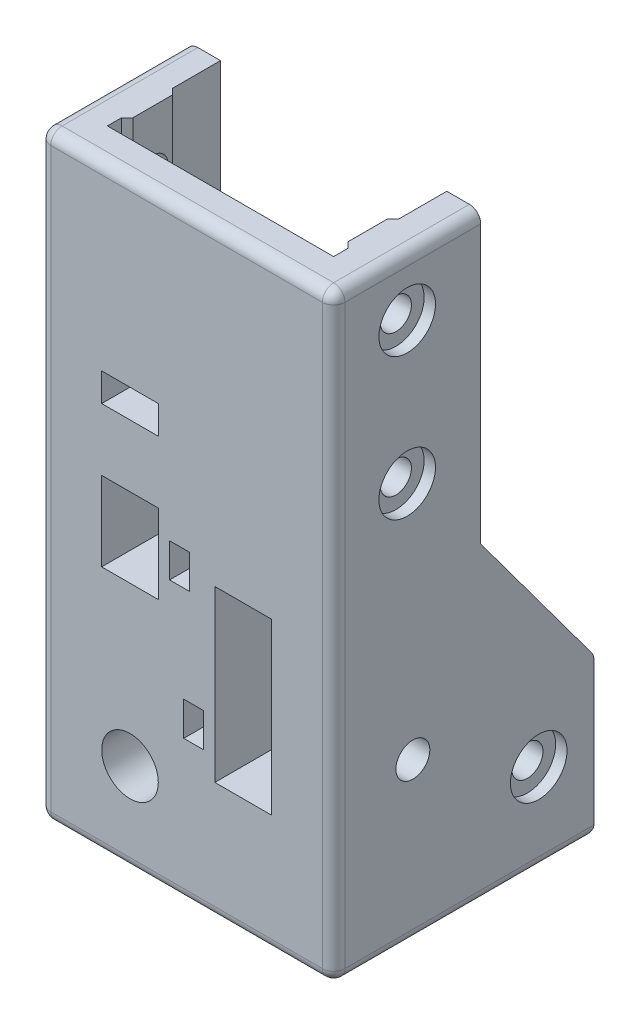
from build123d import *

# Parameters (mm, degrees)
SKETCH1_R                      = 2.75
BOSS_EXTRUDE1_DEPTH            = 26
CHAMFER1_SIZE2                 = 27
CHAMFER1_SIZE                  = 20
SKETCH1_3_W                    = 20
SKETCH1_3_H                    = 48
SKETCH1_3_R                    = 2.75
SKETCH1_3_H_2                  = 49
CUT_EXTRUDE1_DEPTH             = 20
SKETCH2_W                      = 15
SKETCH2_H                      = 12
SKETCH2_W_2                    = 10
SKETCH2_H_2                    = 14
CUT_EXTRUDE2_DEPTH             = 20
SKETCH3_R                      = 2.75
SKETCH3_W                      = 10
SKETCH3_H                      = 5
SKETCH3_H_2                    = 14
CUT_EXTRUDE3_DEPTH             = 119.439858156
SKETCH3_3_R                    = 5
SKETCH3_3_R_2                  = 2.75
SKETCH3_3_W                    = 3.5
SKETCH3_3_H                    = 6
CUT_EXTRUDE4_DEPTH             = 22
SKETCH3_4_W                    = 10
SKETCH3_4_H                    = 11
CUT_EXTRUDE5_DEPTH             = 11
CUT_EXTRUDE6_REACH             = 120.44
SKETCH4_R                      = 1.5
CUT_EXTRUDE6_DIRECTION_2_DEPTH = 119.439858156
SKETCH4_3_R                    = 1.5
CUT_EXTRUDE7_DEPTH             = 119.439858156
CUT_EXTRUDE7_DIRECTION_2_REACH = 120.44
CUT_EXTRUDE8_START             = 18
SKETCH4_4_R                    = 3
SKETCH4_4_R_2                  = 1.5
CUT_EXTRUDE8_DEPTH             = 8
CUT_EXTRUDE9_START             = -18
SKETCH4_5_R                    = 3
SKETCH4_5_R_2                  = 1.5
CUT_EXTRUDE9_DEPTH             = 8
CUT_EXTRUDE10_START            = 24
SKETCH1_4_R                    = 5
SKETCH1_4_R_2                  = 2.75
CUT_EXTRUDE10_DEPTH            = 2
CUT_EXTRUDE11_START            = -26
SKETCH1_5_R                    = 5
SKETCH1_5_R_2                  = 2.75
CUT_EXTRUDE11_DEPTH            = 2
BOSS_EXTRUDE2_START            = -5
SKETCH4_6_R                    = 3
SKETCH4_6_R_2                  = 1.5
BOSS_EXTRUDE2_DEPTH            = 0.5
BOSS_EXTRUDE3_START            = -14.5
SKETCH4_7_R                    = 3
SKETCH4_7_R_2                  = 1.5
BOSS_EXTRUDE3_DEPTH            = 0.5
BOSS_EXTRUDE4_START            = 5
SKETCH4_8_R                    = 3
SKETCH4_8_R_2                  = 1.5
BOSS_EXTRUDE4_DEPTH            = 0.5
BOSS_EXTRUDE5_START            = 14.5
SKETCH4_9_R                    = 3
SKETCH4_9_R_2                  = 1.5
BOSS_EXTRUDE5_DEPTH            = 0.5
SKETCH5_W                      = 9
SKETCH5_H                      = 1
SKETCH5_W_2                    = 1
SKETCH5_H_2                    = 9
BOSS_EXTRUDE6_DEPTH            = 20
BOSS_EXTRUDE7_START            = 52
BOSS_EXTRUDE7_OUTLINE_W        = 1
BOSS_EXTRUDE7_OUTLINE_H        = 9
BOSS_EXTRUDE7_DEPTH            = 48
BOSS_EXTRUDE7_START_2          = 40
BOSS_EXTRUDE7_2_OUTLINE_W      = 1
BOSS_EXTRUDE7_2_OUTLINE_H      = 9
BOSS_EXTRUDE7_2_DEPTH          = 12
CUT_EXTRUDE12_DEPTH            = 119.439858156
CUT_EXTRUDE12_DEPTH_BACK       = 119.439858156
SKETCH1_6_R                    = 2.75
CUT_EXTRUDE13_DEPTH            = 114.101724125
CUT_EXTRUDE13_DEPTH_BACK       = 114.101724125
SKETCH6_3_R                    = 2.75
CUT_EXTRUDE14_START            = -6
SKETCH6_4_R                    = 5
SKETCH6_4_R_2                  = 2.75
CUT_EXTRUDE14_DEPTH            = 2
CHAMFER2_SIZE                  = 1
CHAMFER3_SIZE                  = 0.5
FILLET1_R                      = 2


# Read off the part's stored shape, not the designer's step: Boss-Extrude7
with BuildPart() as part:
    # Sketch1 → Boss-Extrude1 (new, symmetric)
    with BuildSketch(Plane(origin=(0, 0, 0), x_dir=(0, 0, -1), z_dir=(1, 0, 0))):
        Polygon((0, 106), (0, 0), (46, 0), (46, 55), (26, 55), (26, 106), align=None)
        with Locations(Location((13, 95.75, 0), (0, 0, 180))):
            Circle(SKETCH1_R, mode=Mode.SUBTRACT)
        with Locations(Location((13, 70.75, 0), (0, 0, 180))):
            Circle(SKETCH1_R, mode=Mode.SUBTRACT)
        with Locations(Location((36.25, 15.75, 0), (0, 0, 180))):
            Circle(SKETCH1_R, mode=Mode.SUBTRACT)
    extrude(amount=BOSS_EXTRUDE1_DEPTH, both=True)

    # Chamfer1
    chamfer1_edges = [part.edges().sort_by_distance(p)[0] for p in [
        (0, 55, -46),
    ]]
    chamfer1_side = [part.faces().sort_by_distance(p)[0] for p in [
        (0, 55, -45.6),
    ]]
    chamfer(chamfer1_edges, length=CHAMFER1_SIZE - 0.0001, length2=CHAMFER1_SIZE2 - 0.0001, reference=chamfer1_side[0])  # a hair under: the kernel refuses the full size

    # Sketch1<3> → Cut-Extrude1 (cut, symmetric)
    # profile 1 of 2: a face of its own
    with BuildSketch(Plane(origin=(0, 0, 0), x_dir=(0, 0, -1), z_dir=(1, 0, 0))):
        with Locations((16, 82)):
            Rectangle(SKETCH1_3_W, SKETCH1_3_H)
        with Locations(Location((13, 95.75, 0), (0, 0, 180))):
            Circle(SKETCH1_3_R, mode=Mode.SUBTRACT)
        with Locations(Location((13, 70.75, 0), (0, 0, 180))):
            Circle(SKETCH1_3_R, mode=Mode.SUBTRACT)
    # profile 2 of 2: a face of its own
    with BuildSketch(Plane(origin=(0, 0, 0), x_dir=(0, 0, -1), z_dir=(1, 0, 0))):
        with Locations((36, 30.5)):
            Rectangle(SKETCH1_3_W, SKETCH1_3_H_2)
        with Locations(Location((36.25, 15.75, 0), (0, 0, 180))):
            Circle(SKETCH1_3_R, mode=Mode.SUBTRACT)
    extrude(amount=CUT_EXTRUDE1_DEPTH, both=True, mode=Mode.SUBTRACT)

    # Sketch2 → Cut-Extrude2 (cut)
    with BuildSketch(Plane(origin=(0, 0, -26), x_dir=(-1, 0, 0), z_dir=(0, 0, -1))):
        with Locations((-12.5, 52)):
            Rectangle(SKETCH2_W, SKETCH2_H)
        with Locations((10, 51)):
            Rectangle(SKETCH2_W_2, SKETCH2_H_2)
    extrude(amount=-CUT_EXTRUDE2_DEPTH, mode=Mode.SUBTRACT)

    # Sketch3 → Cut-Extrude3 (cut, through all)
    with BuildSketch(Plane.XY):
        with Locations((-10, 16)):
            Circle(SKETCH3_R)
        with Locations((10, 48.5)):
            Rectangle(SKETCH3_W, SKETCH3_H)
        with Locations((10, 28)):
            Rectangle(SKETCH3_W, SKETCH3_H_2)
        with Locations((-10, 51)):
            Rectangle(SKETCH3_W, SKETCH3_H_2)
        with Locations((-10, 71.5)):
            Rectangle(SKETCH3_W, SKETCH3_H)
    extrude(amount=-CUT_EXTRUDE3_DEPTH, mode=Mode.SUBTRACT)

    # Sketch3<3> → Cut-Extrude4 (cut)
    # profile 1 of 3: a face of its own
    with BuildSketch(Plane.XY):
        with Locations((-10, 16)):
            Circle(SKETCH3_3_R)
        with Locations((-10, 16)):
            Circle(SKETCH3_3_R_2, mode=Mode.SUBTRACT)
    # profile 2 of 3: a face of its own
    with BuildSketch(Plane.XY):
        with Locations((1.25, 28)):
            Rectangle(SKETCH3_3_W, SKETCH3_3_H)
    # profile 3 of 3: a face of its own
    with BuildSketch(Plane.XY):
        with Locations((-1.25, 51)):
            Rectangle(SKETCH3_3_W, SKETCH3_3_H)
    extrude(amount=-CUT_EXTRUDE4_DEPTH, mode=Mode.SUBTRACT)

    # Sketch3<4> → Cut-Extrude5 (cut)
    with BuildSketch(Plane.XY):
        with Locations((10, 40.5)):
            Rectangle(SKETCH3_4_W, SKETCH3_4_H)
    extrude(amount=-CUT_EXTRUDE5_DEPTH, mode=Mode.SUBTRACT)

    # Cut-Extrude6: up to this face of the body (flat: up to its plane)
    cut_extrude6_end = Plane(part.part.faces().sort_by_distance((-15, 51, -13))[0])
    # Sketch4 → Cut-Extrude6 (cut, up to the picked face)
    with BuildSketch(Plane(origin=(0, 0, 0), x_dir=(0, 0, -1), z_dir=(1, 0, 0)), mode=Mode.PRIVATE) as cut_extrude6_sk1:
        with Locations((14, 28)):
            Circle(SKETCH4_R)
    cut_extrude6_tool1 = split(extrude(cut_extrude6_sk1.sketch, amount=-CUT_EXTRUDE6_REACH, mode=Mode.PRIVATE), bisect_by=cut_extrude6_end, keep=Keep.BOTH, mode=Mode.PRIVATE)
    add(cut_extrude6_tool1.solids().sort_by(Axis((0, 28, -14), (-1, 0, 0)))[0], mode=Mode.SUBTRACT)

    # Sketch4 → Cut-Extrude6 direction 2 (cut)
    with BuildSketch(Plane(origin=(0, 0, 0), x_dir=(0, 0, -1), z_dir=(1, 0, 0))):
        with Locations((14, 28)):
            Circle(SKETCH4_R)
    extrude(amount=CUT_EXTRUDE6_DIRECTION_2_DEPTH, mode=Mode.SUBTRACT)

    # Sketch4<3> → Cut-Extrude7 (cut)
    with BuildSketch(Plane(origin=(0, 0, 0), x_dir=(0, 0, -1), z_dir=(1, 0, 0))):
        with Locations((14, 51)):
            Circle(SKETCH4_3_R)
    extrude(amount=-CUT_EXTRUDE7_DEPTH, mode=Mode.SUBTRACT)

    # Cut-Extrude7 direction 2: up to this face of the body (flat: up to its plane)
    cut_extrude7_direction_2_end = Plane(part.part.faces().sort_by_distance((15, 32.18855761, -10.608794133))[0])
    # Sketch4<3> → Cut-Extrude7 direction 2 (cut, up to the picked face)
    with BuildSketch(Plane(origin=(0, 0, 0), x_dir=(0, 0, -1), z_dir=(1, 0, 0)), mode=Mode.PRIVATE) as cut_extrude7_direction_2_sk1:
        with Locations((14, 51)):
            Circle(SKETCH4_3_R)
    cut_extrude7_direction_2_tool1 = split(extrude(cut_extrude7_direction_2_sk1.sketch, amount=CUT_EXTRUDE7_DIRECTION_2_REACH, mode=Mode.PRIVATE), bisect_by=cut_extrude7_direction_2_end, keep=Keep.BOTH, mode=Mode.PRIVATE)
    add(cut_extrude7_direction_2_tool1.solids().sort_by(Axis((0, 51, -14), (1, 0, 0)))[0], mode=Mode.SUBTRACT)

    # Sketch4<4> → Cut-Extrude8 (cut)
    with BuildSketch(Plane(origin=(0, 0, 0), x_dir=(0, 0, -1), z_dir=(1, 0, 0)).offset(CUT_EXTRUDE8_START)):
        with Locations((14, 28)):
            Circle(SKETCH4_4_R)
        with Locations((14, 28)):
            Circle(SKETCH4_4_R_2, mode=Mode.SUBTRACT)
    extrude(amount=CUT_EXTRUDE8_DEPTH, mode=Mode.SUBTRACT)

    # Sketch4<5> → Cut-Extrude9 (cut)
    with BuildSketch(Plane(origin=(0, 0, 0), x_dir=(0, 0, -1), z_dir=(1, 0, 0)).offset(CUT_EXTRUDE9_START)):
        with Locations((14, 51)):
            Circle(SKETCH4_5_R)
        with Locations((14, 51)):
            Circle(SKETCH4_5_R_2, mode=Mode.SUBTRACT)
    extrude(amount=-CUT_EXTRUDE9_DEPTH, mode=Mode.SUBTRACT)

    # Sketch1<4> → Cut-Extrude10 (cut)
    # profile 1 of 3: a face of its own
    with BuildSketch(Plane(origin=(0, 0, 0), x_dir=(0, 0, -1), z_dir=(1, 0, 0)).offset(CUT_EXTRUDE10_START)):
        with Locations((13, 95.75)):
            Circle(SKETCH1_4_R)
        with Locations(Location((13, 95.75, 0), (0, 0, 180))):
            Circle(SKETCH1_4_R_2, mode=Mode.SUBTRACT)
    # profile 2 of 3: a face of its own
    with BuildSketch(Plane(origin=(0, 0, 0), x_dir=(0, 0, -1), z_dir=(1, 0, 0)).offset(CUT_EXTRUDE10_START)):
        with Locations((13, 70.75)):
            Circle(SKETCH1_4_R)
        with Locations(Location((13, 70.75, 0), (0, 0, 180))):
            Circle(SKETCH1_4_R_2, mode=Mode.SUBTRACT)
    # profile 3 of 3: a face of its own
    with BuildSketch(Plane(origin=(0, 0, 0), x_dir=(0, 0, -1), z_dir=(1, 0, 0)).offset(CUT_EXTRUDE10_START)):
        with Locations((36.25, 15.75)):
            Circle(SKETCH1_4_R)
        with Locations(Location((36.25, 15.75, 0), (0, 0, 180))):
            Circle(SKETCH1_4_R_2, mode=Mode.SUBTRACT)
    extrude(amount=CUT_EXTRUDE10_DEPTH, mode=Mode.SUBTRACT)

    # Sketch1<5> → Cut-Extrude11 (cut)
    # profile 1 of 3: a face of its own
    with BuildSketch(Plane(origin=(0, 0, 0), x_dir=(0, 0, -1), z_dir=(1, 0, 0)).offset(CUT_EXTRUDE11_START)):
        with Locations((36.25, 15.75)):
            Circle(SKETCH1_5_R)
        with Locations(Location((36.25, 15.75, 0), (0, 0, 180))):
            Circle(SKETCH1_5_R_2, mode=Mode.SUBTRACT)
    # profile 2 of 3: a face of its own
    with BuildSketch(Plane(origin=(0, 0, 0), x_dir=(0, 0, -1), z_dir=(1, 0, 0)).offset(CUT_EXTRUDE11_START)):
        with Locations((13, 70.75)):
            Circle(SKETCH1_5_R)
        with Locations(Location((13, 70.75, 0), (0, 0, 180))):
            Circle(SKETCH1_5_R_2, mode=Mode.SUBTRACT)
    # profile 3 of 3: a face of its own
    with BuildSketch(Plane(origin=(0, 0, 0), x_dir=(0, 0, -1), z_dir=(1, 0, 0)).offset(CUT_EXTRUDE11_START)):
        with Locations((13, 95.75)):
            Circle(SKETCH1_5_R)
        with Locations(Location((13, 95.75, 0), (0, 0, 180))):
            Circle(SKETCH1_5_R_2, mode=Mode.SUBTRACT)
    extrude(amount=CUT_EXTRUDE11_DEPTH, mode=Mode.SUBTRACT)

    # Sketch4<6> → Boss-Extrude2 (add)
    with BuildSketch(Plane(origin=(0, 0, 0), x_dir=(0, 0, -1), z_dir=(1, 0, 0)).offset(BOSS_EXTRUDE2_START)):
        with Locations((14, 51)):
            Circle(SKETCH4_6_R)
        with Locations((14, 51)):
            Circle(SKETCH4_6_R_2, mode=Mode.SUBTRACT)
    extrude(amount=-BOSS_EXTRUDE2_DEPTH)

    # Sketch4<7> → Boss-Extrude3 (add)
    with BuildSketch(Plane(origin=(0, 0, 0), x_dir=(0, 0, -1), z_dir=(1, 0, 0)).offset(BOSS_EXTRUDE3_START)):
        with Locations((14, 51)):
            Circle(SKETCH4_7_R)
        with Locations((14, 51)):
            Circle(SKETCH4_7_R_2, mode=Mode.SUBTRACT)
    extrude(amount=-BOSS_EXTRUDE3_DEPTH)

    # Sketch4<8> → Boss-Extrude4 (add)
    with BuildSketch(Plane(origin=(0, 0, 0), x_dir=(0, 0, -1), z_dir=(1, 0, 0)).offset(BOSS_EXTRUDE4_START)):
        with Locations((14, 28)):
            Circle(SKETCH4_8_R)
        with Locations((14, 28)):
            Circle(SKETCH4_8_R_2, mode=Mode.SUBTRACT)
    extrude(amount=BOSS_EXTRUDE4_DEPTH)

    # Sketch4<9> → Boss-Extrude5 (add)
    with BuildSketch(Plane(origin=(0, 0, 0), x_dir=(0, 0, -1), z_dir=(1, 0, 0)).offset(BOSS_EXTRUDE5_START)):
        with Locations((14, 28)):
            Circle(SKETCH4_9_R)
        with Locations((14, 28)):
            Circle(SKETCH4_9_R_2, mode=Mode.SUBTRACT)
    extrude(amount=BOSS_EXTRUDE5_DEPTH)

    # Sketch5 → Boss-Extrude6 (add)
    with BuildSketch(Plane(origin=(0, 0, -46), x_dir=(-1, 0, 0), z_dir=(0, 0, -1))):
        with Locations((-9.75, 6.5)):
            Rectangle(SKETCH5_W, SKETCH5_H)
        with Locations((9.75, 6.5)):
            Rectangle(SKETCH5_W, SKETCH5_H)
        with Locations((-19.5, 15.75)):
            Rectangle(SKETCH5_W_2, SKETCH5_H_2)
        with Locations((19.5, 15.75)):
            Rectangle(SKETCH5_W_2, SKETCH5_H_2)
    extrude(amount=-BOSS_EXTRUDE6_DEPTH)

    # Boss-Extrude7 outline → Boss-Extrude7 (add)
    with BuildSketch(Plane(origin=(0, 6, 0), x_dir=(1, 0, 0), z_dir=(0, 1, 0)).offset(BOSS_EXTRUDE7_START)):
        with Locations((19.5, 13)):
            Rectangle(BOSS_EXTRUDE7_OUTLINE_W, BOSS_EXTRUDE7_OUTLINE_H)
        with Locations((-19.5, 13)):
            Rectangle(BOSS_EXTRUDE7_OUTLINE_W, BOSS_EXTRUDE7_OUTLINE_H)
    extrude(amount=BOSS_EXTRUDE7_DEPTH)

    # Boss-Extrude7 2 outline → Boss-Extrude7 2 (add)
    with BuildSketch(Plane(origin=(0, 6, 0), x_dir=(1, 0, 0), z_dir=(0, 1, 0)).offset(BOSS_EXTRUDE7_START_2)):
        with Locations((19.5, 13)):
            Rectangle(BOSS_EXTRUDE7_2_OUTLINE_W, BOSS_EXTRUDE7_2_OUTLINE_H)
    extrude(amount=BOSS_EXTRUDE7_2_DEPTH)

    # Sketch1<6> → Cut-Extrude12 (cut, two sides: drawn at the far end of the back side and taken through both)
    with BuildSketch(Plane(origin=(0, 0, 0), x_dir=(0, 0, -1), z_dir=(1, 0, 0)).offset(-CUT_EXTRUDE12_DEPTH_BACK)):
        with Locations(Location((13, 95.75, 0), (0, 0, 180))):
            Circle(SKETCH1_6_R)
        with Locations(Location((13, 70.75, 0), (0, 0, 180))):
            Circle(SKETCH1_6_R)
        with Locations(Location((36.25, 15.75, 0), (0, 0, 180))):
            Circle(SKETCH1_6_R)
    extrude(amount=CUT_EXTRUDE12_DEPTH + CUT_EXTRUDE12_DEPTH_BACK, mode=Mode.SUBTRACT)

    # Sketch6<3> → Cut-Extrude13 (cut, two sides: drawn at the far end of the back side and taken through both)
    with BuildSketch(Plane(origin=(0, 6, 0), x_dir=(1, 0, 0), z_dir=(0, 1, 0)).offset(-CUT_EXTRUDE13_DEPTH_BACK)):
        with Locations(Location((-9.75, 36.25, 0), (0, 0, 270))):
            Circle(SKETCH6_3_R)
        with Locations(Location((9.75, 36.25, 0), (0, 0, 270))):
            Circle(SKETCH6_3_R)
    extrude(amount=CUT_EXTRUDE13_DEPTH + CUT_EXTRUDE13_DEPTH_BACK, mode=Mode.SUBTRACT)

    # Sketch6<4> → Cut-Extrude14 (cut)
    # profile 1 of 2: a face of its own
    with BuildSketch(Plane(origin=(0, 6, 0), x_dir=(1, 0, 0), z_dir=(0, 1, 0)).offset(CUT_EXTRUDE14_START)):
        with Locations(Location((9.75, 36.25, 0), (0, 0, 90))):
            Circle(SKETCH6_4_R)
        with Locations(Location((9.75, 36.25, 0), (0, 0, 270))):
            Circle(SKETCH6_4_R_2, mode=Mode.SUBTRACT)
    # profile 2 of 2: a face of its own
    with BuildSketch(Plane(origin=(0, 6, 0), x_dir=(1, 0, 0), z_dir=(0, 1, 0)).offset(CUT_EXTRUDE14_START)):
        with Locations(Location((-9.75, 36.25, 0), (0, 0, 90))):
            Circle(SKETCH6_4_R)
        with Locations(Location((-9.75, 36.25, 0), (0, 0, 270))):
            Circle(SKETCH6_4_R_2, mode=Mode.SUBTRACT)
    extrude(amount=CUT_EXTRUDE14_DEPTH, mode=Mode.SUBTRACT)

    # Chamfer2
    chamfer2_edges = [part.edges().sort_by_distance(p)[0] for p in [
        (-19, 11.25, -36),
        (-19, 20.25, -36),
        (-5.25, 7, -36),
        (-14.25, 7, -36),
        (5.25, 7, -36),
        (14.25, 7, -36),
        (19, 11.25, -36),
        (19, 20.25, -36),
        (19, 76, -8.5),
        (19, 76, -17.5),
        (-19, 82, -8.5),
        (-19, 82, -17.5),
    ]]
    chamfer(chamfer2_edges, length=CHAMFER2_SIZE - 0.0001)  # a hair under: the kernel refuses the full size

    # Chamfer3
    chamfer3_edges = [part.edges().sort_by_distance(p)[0] for p in [
        (-5.5, 51, -11),
        (-14.5, 51, -11),
        (5.5, 28, -11),
        (14.5, 28, -11),
    ]]
    chamfer(chamfer3_edges, length=CHAMFER3_SIZE - 0.0001)  # a hair under: the kernel refuses the full size

    # Fillet1
    fillet1_edges = [part.edges().sort_by_distance(p)[0] for p in [
        (26, 106, -13),
        (-26, 0, -23),
        (-26, 53, 0),
        (-26, 106, -13),
        (0, 0, -46),
        (26, 53, 0),
        (0, 0, 0),
        (0, 106, 0),
        (26, 0, -23),
        (-23, 28.0001, -46),
        (23, 28.0001, -46),
    ]]
    fillet(fillet1_edges, radius=FILLET1_R)


solid = part.part
